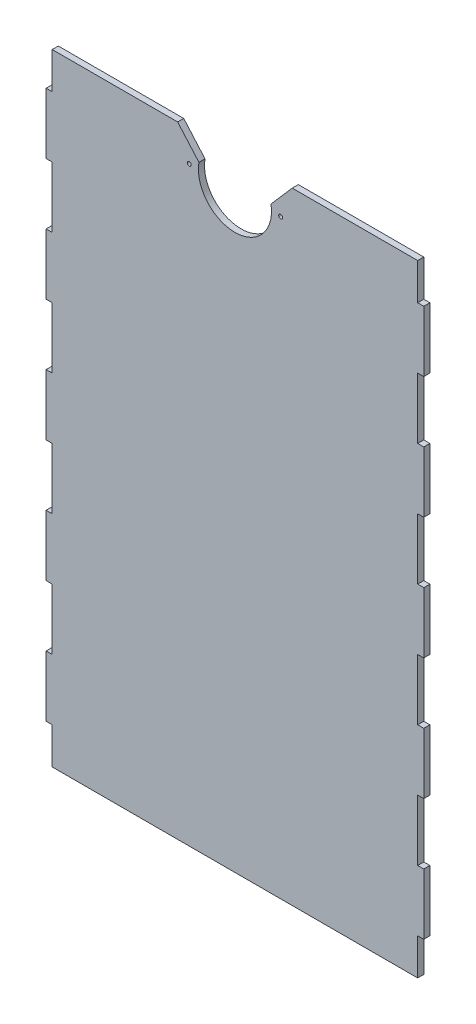
from build123d import *

# Parameters (mm, degrees)
SKETCH_1_W          = 310
SKETCH_1_H          = 510
EXTRUDE_1_DEPTH     = 5
SKETCH_2_W          = 5
SKETCH_2_H          = 50
CUT_EXTRUDE_1_DEPTH = 5
CUT_EXTRUDE_2_DEPTH = 299.454351618
SKETCH_5_R          = 1.6
CUT_EXTRUDE_3_DEPTH = 299.454351618


with BuildPart() as part:
    # ｽｹｯﾁ1 → ﾎﾞｽ - 押し出し1 (new body)
    with BuildSketch(Plane.XY):
        Rectangle(SKETCH_1_W, SKETCH_1_H)
    extrude(amount=EXTRUDE_1_DEPTH)

    # ｽｹｯﾁ2 → ｶｯﾄ - 押し出し1 (cut)
    with BuildSketch(Plane.XY.offset(5)):
        with Locations((152.5, 50)):
            Rectangle(SKETCH_2_W, SKETCH_2_H)
        with Locations((152.5, -50)):
            Rectangle(SKETCH_2_W, SKETCH_2_H)
        with Locations((152.5, 150)):
            Rectangle(SKETCH_2_W, SKETCH_2_H)
        with Locations((152.5, -150)):
            Rectangle(SKETCH_2_W, SKETCH_2_H)
        with Locations((152.5, 250)):
            Rectangle(SKETCH_2_W, SKETCH_2_H)
        with Locations((152.5, -250)):
            Rectangle(SKETCH_2_W, SKETCH_2_H)
        with Locations((-152.5, 50)):
            Rectangle(SKETCH_2_W, SKETCH_2_H)
        with Locations((-152.5, -50)):
            Rectangle(SKETCH_2_W, SKETCH_2_H)
        with Locations((-152.5, 150)):
            Rectangle(SKETCH_2_W, SKETCH_2_H)
        with Locations((-152.5, -150)):
            Rectangle(SKETCH_2_W, SKETCH_2_H)
        with Locations((-152.5, 250)):
            Rectangle(SKETCH_2_W, SKETCH_2_H)
        with Locations((-152.5, -250)):
            Rectangle(SKETCH_2_W, SKETCH_2_H)
    extrude(amount=-CUT_EXTRUDE_1_DEPTH, mode=Mode.SUBTRACT)

    # ｽｹｯﾁ3 → ｶｯﾄ - 押し出し2 (cut, through all)
    with BuildSketch(Plane.XY.offset(5)):
        with BuildLine():
            Line((47.033321686, 255), (29.580398915, 235))
            ThreePointArc((29.580398915, 235), (0, 200), (-29.580398915, 235))
            Line((-29.580398915, 235), (-47.033321686, 255))
            Line((-47.033321686, 255), (47.033321686, 255))
        make_face()
    extrude(amount=-CUT_EXTRUDE_2_DEPTH, mode=Mode.SUBTRACT)

    # ｽｹｯﾁ5 → ｶｯﾄ - 押し出し3 (cut, through all)
    with BuildSketch(Plane.XY.offset(5)):
        with Locations((-37.5, 230)):
            Circle(SKETCH_5_R)
        with Locations((37.5, 230)):
            Circle(SKETCH_5_R)
    extrude(amount=-CUT_EXTRUDE_3_DEPTH, mode=Mode.SUBTRACT)


solid = part.part
